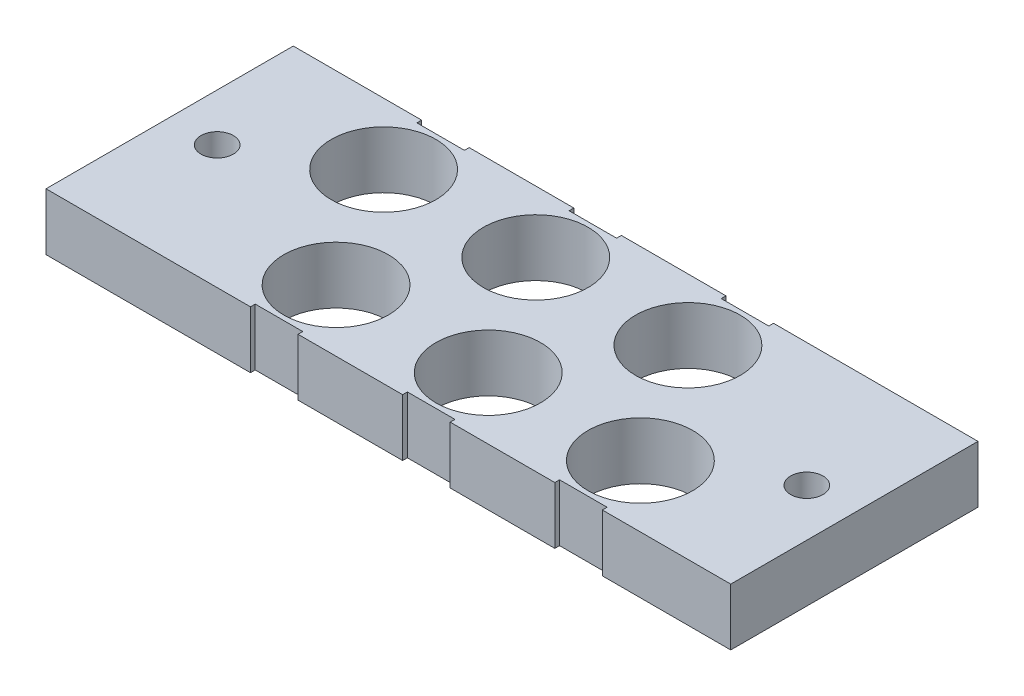
from build123d import *

# Parameters (mm, degrees)
SKETCH1_R             = 5.5
BOSS_EXTRUDE1_DEPTH   = 6
BOSS_EXTRUDE1_2_DEPTH = 6
BOSS_EXTRUDE1_3_DEPTH = 6
BOSS_EXTRUDE1_4_DEPTH = 6
BOSS_EXTRUDE1_5_DEPTH = 6
BOSS_EXTRUDE1_6_DEPTH = 6
SKETCH1_3_R           = 1.7
BOSS_EXTRUDE2_DEPTH   = 6
CUT_EXTRUDE1_DEPTH    = 1


with BuildPart() as part:
    # Sketch1 → Boss-Extrude1 (new body)
    with BuildSketch(Plane(origin=(0, 0, 0), x_dir=(1, 0, 0), z_dir=(0, 1, 0))):
        Polygon((2.68639507, -4.66487452), (-9.31360493, -4.664874562), (-9.313604887, -16.664874562), (2.686395113, -16.66487452), align=None)
        with Locations((-3.313604908, -10.664874541)):
            Circle(SKETCH1_R, mode=Mode.SUBTRACT)
    extrude(amount=-BOSS_EXTRUDE1_DEPTH)



with BuildPart() as body_2:
    # Sketch1 → Boss-Extrude1 2 (new body)
    with BuildSketch(Plane(origin=(0, 0, 0), x_dir=(1, 0, 0), z_dir=(0, 1, 0))):
        Polygon((18.68639507, -4.664873819), (6.68639507, -4.664873862), (6.686395113, -16.664873862), (18.686395113, -16.664873819), align=None)
        with Locations((12.686395092, -10.66487384)):
            Circle(SKETCH1_R, mode=Mode.SUBTRACT)
    extrude(amount=-BOSS_EXTRUDE1_2_DEPTH)


with BuildPart() as body_3:
    # Sketch1 → Boss-Extrude1 3 (new body)
    with BuildSketch(Plane(origin=(0, 0, 0), x_dir=(1, 0, 0), z_dir=(0, 1, 0))):
        Polygon((-1.313604837, -29.664873456), (10.686395163, -29.664873413), (10.68639512, -17.664873413), (-1.31360488, -17.664873456), align=None)
        with Locations((4.686395141, -23.664873434)):
            Circle(SKETCH1_R, mode=Mode.SUBTRACT)
    extrude(amount=-BOSS_EXTRUDE1_3_DEPTH)


with BuildPart() as body_4:
    # Sketch1 → Boss-Extrude1 4 (new body)
    with BuildSketch(Plane(origin=(0, 0, 0), x_dir=(1, 0, 0), z_dir=(0, 1, 0))):
        Polygon((14.686395163, -29.664873833), (26.686395163, -29.664873791), (26.68639512, -17.664873791), (14.68639512, -17.664873833), align=None)
        with Locations((20.686395141, -23.664873812)):
            Circle(SKETCH1_R, mode=Mode.SUBTRACT)
    extrude(amount=-BOSS_EXTRUDE1_4_DEPTH)


with BuildPart() as body_5:
    # Sketch1 → Boss-Extrude1 5 (new body)
    with BuildSketch(Plane(origin=(0, 0, 0), x_dir=(1, 0, 0), z_dir=(0, 1, 0))):
        Polygon((34.68639507, -4.664873762), (22.68639507, -4.664873805), (22.686395113, -16.664873805), (34.686395113, -16.664873762), align=None)
        with Locations((28.686395092, -10.664873784)):
            Circle(SKETCH1_R, mode=Mode.SUBTRACT)
    extrude(amount=-BOSS_EXTRUDE1_5_DEPTH)


with BuildPart() as body_6:
    # Sketch1 → Boss-Extrude1 6 (new body)
    with BuildSketch(Plane(origin=(0, 0, 0), x_dir=(1, 0, 0), z_dir=(0, 1, 0))):
        Polygon((30.686395163, -29.664873979), (42.686395163, -29.664873936), (42.68639512, -17.664873936), (30.68639512, -17.664873979), align=None)
        with Locations((36.686395141, -23.664873958)):
            Circle(SKETCH1_R, mode=Mode.SUBTRACT)
    extrude(amount=-BOSS_EXTRUDE1_6_DEPTH)


with BuildPart() as part_1:
    add(part.part)

    add(body_2.part)  # Boss-Extrude2 merges body 2

    add(body_3.part)  # Boss-Extrude2 merges body 3

    add(body_4.part)  # Boss-Extrude2 merges body 4

    add(body_5.part)  # Boss-Extrude2 merges body 5

    add(body_6.part)  # Boss-Extrude2 merges body 6
    # Sketch1<3> → Boss-Extrude2 (add)
    with BuildSketch(Plane(origin=(0, 0, 0), x_dir=(1, 0, 0), z_dir=(0, 1, 0))):
        Polygon((6.186395002, -4.164873846), (3.186395002, -4.1648745), (-0.813604931, -4.164874532), (-0.81360493, -4.664874532), (2.68639507, -4.66487452), (2.686395113, -16.66487452), (-9.313604887, -16.664874562), (-9.31360493, -4.664874562), (-5.81360493, -4.66487455), (-5.813604931, -4.16487455), (-9.813604931, -4.164874564), (-19.313604998, -4.164874546), (-19.313604998, -30.16487344), (-1.813604902, -30.16487344), (2.186395164, -30.164873443), (2.186395163, -29.664873443), (-1.313604837, -29.664873456), (-1.31360488, -17.664873456), (10.68639512, -17.664873413), (10.686395163, -29.664873413), (7.186395163, -29.664873425), (7.186395164, -30.164873425), (11.186395164, -30.164873411), (14.186395098, -30.164873817), (18.186395164, -30.164873821), (18.186395163, -29.664873821), (14.686395163, -29.664873833), (14.68639512, -17.664873833), (26.68639512, -17.664873791), (26.686395163, -29.664873791), (23.186395163, -29.664873803), (23.186395164, -30.164873803), (27.186395164, -30.164873789), (30.186395098, -30.164873963), (34.186395164, -30.164873966), (34.186395163, -29.664873966), (30.686395163, -29.664873979), (30.68639512, -17.664873979), (42.68639512, -17.664873936), (42.686395163, -29.664873936), (39.186395163, -29.664873949), (39.186395164, -30.164873949), (43.186395164, -30.164873935), (52.686395098, -30.16487344), (52.686395098, -4.164874546), (35.186395002, -4.164873743), (31.186395069, -4.164873775), (31.18639507, -4.664873775), (34.68639507, -4.664873762), (34.686395113, -16.664873762), (22.686395113, -16.664873805), (22.68639507, -4.664873805), (26.18639507, -4.664873793), (26.186395069, -4.164873793), (22.186395069, -4.164873807), (19.186395002, -4.1648738), (15.186395069, -4.164873832), (15.18639507, -4.664873832), (18.68639507, -4.664873819), (18.686395113, -16.664873819), (6.686395113, -16.664873862), (6.68639507, -4.664873862), (10.18639507, -4.664873849), (10.186395069, -4.164873849), align=None)
        with Locations((-14.313604998, -17.164873993)):
            Circle(SKETCH1_3_R, mode=Mode.SUBTRACT)
        with Locations((47.686395098, -17.164873993)):
            Circle(SKETCH1_3_R, mode=Mode.SUBTRACT)
    extrude(amount=-BOSS_EXTRUDE2_DEPTH)

    # Sketch2 → Cut-Extrude1 (cut)
    # profile 1 of 2: a face of its own
    with BuildSketch(Plane(origin=(0, -6, 0), x_dir=(-1, 0, 0), z_dir=(0, -1, 0))):
        Polygon((6.699801581, -23.2390136), (8.246596453, -23.2390136), (8.246596453, -23.564654626), (6.984737478, -23.564654626), (6.984737478, -24.541577703), (8.246596453, -24.541577703), (8.246596453, -24.867218728), (6.984737478, -24.867218728), (6.984737478, -26.4140136), (6.699801581, -26.4140136), align=None)
    # profile 2 of 2: a face of its own
    with BuildSketch(Plane(origin=(0, -6, 0), x_dir=(-1, 0, 0), z_dir=(0, -1, 0))):
        with BuildLine():
            Line((9.996916965, -23.157603344), (10.216979065, -23.329964121))
            Line((10.216979065, -23.329964121), (9.378071813, -24.612811677))
            add(Edge.make_bspline(
                [(9.378071813, -24.612811677), (9.43392485, -24.603909103), (9.542872514, -24.586543627), (9.65315015, -24.583678919), (9.706892927, -24.582282831)],
                knots=[0, 0, 0, 0, 1.025318673, 2, 2, 2, 2], degree=3))
            add(Edge.make_bspline(
                [(9.706892927, -24.582282831), (9.739163887, -24.583137599), (9.802478203, -24.584814619), (9.895509725, -24.598067595), (9.984924431, -24.618695779), (10.070522851, -24.64888638), (10.152413619, -24.68743998), (10.231065003, -24.733649384), (10.30499899, -24.789897237), (10.375167554, -24.852730491), (10.438873565, -24.922323744), (10.49527613, -24.996166388), (10.542653291, -25.074181472), (10.581092491, -25.156329486), (10.610941917, -25.2424838), (10.632702138, -25.332534184), (10.645565054, -25.426542733), (10.647311749, -25.490476506), (10.648199017, -25.522952903)],
                knots=[0, 0, 0, 0, 1.044136307, 2.048553127, 3.035567123, 4.010001674, 4.980053131, 5.96154148, 6.956538004, 7.981742224, 9.006487041, 10.005615874, 10.984750588, 11.954802044, 12.935714515, 13.930994945, 14.949008866, 16, 16, 16, 16], degree=3))
            add(Edge.make_bspline(
                [(10.648199017, -25.522952903), (10.646908057, -25.567384491), (10.644367755, -25.654815343), (10.619055025, -25.782157069), (10.579721633, -25.903471565), (10.523499161, -26.016821942), (10.453665142, -26.122052845), (10.368504755, -26.215293946), (10.271038162, -26.298451765), (10.160832281, -26.36799027), (10.042229735, -26.42478018), (9.917631851, -26.465570078), (9.788248654, -26.49068294), (9.700433045, -26.493831272), (9.656011517, -26.495423856)],
                knots=[0, 0, 0, 0, 1.031375318, 2.029502543, 3.004789286, 3.987476834, 4.960371455, 5.9300674, 6.912260825, 7.929083631, 8.949397511, 9.960523116, 10.96833055, 12, 12, 12, 12], degree=3))
            add(Edge.make_bspline(
                [(9.656011517, -26.495423856), (9.613288081, -26.494037555), (9.528660436, -26.491291536), (9.404170686, -26.466829578), (9.284552092, -26.427180992), (9.170642725, -26.372558039), (9.065123312, -26.303562674), (8.970720913, -26.220502607), (8.887906232, -26.125153306), (8.818986397, -26.017529563), (8.764323119, -25.901877958), (8.723329401, -25.781284966), (8.699384238, -25.656189983), (8.69603819, -25.571389235), (8.694352863, -25.528677062)],
                knots=[0, 0, 0, 0, 1.012016664, 2.004627821, 2.994792927, 3.992885782, 4.990978636, 5.973936114, 6.964471063, 7.975201453, 8.993600317, 9.990122807, 10.98767138, 12, 12, 12, 12], degree=3))
            add(Edge.make_bspline(
                [(8.694352863, -25.528677062), (8.695424602, -25.495979475), (8.697612889, -25.429217252), (8.712892251, -25.328103455), (8.737443886, -25.224642831), (8.764939609, -25.136872955), (8.793991413, -25.064971432), (8.818169074, -25.007001837), (8.848262627, -24.947347149), (8.880351337, -24.883961779), (8.91732364, -24.818479279), (8.957524265, -24.749805236), (9.002064662, -24.679031831), (9.033288667, -24.631003882), (9.049250699, -24.606451501)],
                knots=[0, 0, 0, 0, 1.173818275, 2.396712641, 3.66331629, 4.989737886, 5.693666774, 6.447286557, 7.243889047, 8.091586357, 8.998013824, 9.943181721, 10.948533338, 12, 12, 12, 12], degree=3))
            Line((9.049250699, -24.606451501), (9.996916965, -23.157603344))
        make_face()
        with BuildLine():
            add(Edge.make_bspline(
                [(9.64710727, -24.907923856), (9.622921579, -24.908639019), (9.575469451, -24.910042162), (9.505937895, -24.917966716), (9.440309411, -24.932982832), (9.377830069, -24.952402516), (9.31916676, -24.978858553), (9.263592246, -25.010560401), (9.211746157, -25.048541998), (9.16388158, -25.091418934), (9.120507249, -25.138406483), (9.083148796, -25.188723076), (9.050925237, -25.241169384), (9.024725214, -25.296180139), (9.004323526, -25.353735218), (8.989565892, -25.413569669), (8.981352848, -25.476084793), (8.97998648, -25.518477849), (8.97928876, -25.540125379)],
                knots=[0, 0, 0, 0, 1.128956033, 2.215002439, 3.259141796, 4.2666399, 5.263148119, 6.255916712, 7.247353359, 8.256307737, 9.250603402, 10.226115518, 11.176314381, 12.118911324, 13.063945463, 14.021379252, 14.989639887, 16, 16, 16, 16], degree=3))
            add(Edge.make_bspline(
                [(8.97928876, -25.540125379), (8.97985696, -25.561579289), (8.980971114, -25.603647213), (8.991087861, -25.665640612), (9.006541115, -25.725298779), (9.029528474, -25.782314158), (9.056948579, -25.837555818), (9.093148409, -25.889022827), (9.133259351, -25.939841033), (9.181205419, -25.986106654), (9.232661612, -26.029156591), (9.28763556, -26.066785107), (9.344930667, -26.098976136), (9.405320457, -26.124204774), (9.467948134, -26.144909663), (9.533335493, -26.159479719), (9.601528012, -26.167717054), (9.647721485, -26.169085201), (9.67127594, -26.169782831)],
                knots=[0, 0, 0, 0, 0.989467248, 1.94019797, 2.891935182, 3.827694429, 4.772920941, 5.730924762, 6.725747692, 7.756678648, 8.79901574, 9.819492441, 10.826891316, 11.826466727, 12.835195252, 13.867842842, 14.912794438, 16, 16, 16, 16], degree=3))
            add(Edge.make_bspline(
                [(9.67127594, -26.169782831), (9.694830356, -26.169085146), (9.741023753, -26.167716892), (9.809216821, -26.159480335), (9.874602152, -26.144907404), (9.9372372, -26.124212963), (9.997599783, -26.09894576), (10.054844781, -26.066985375), (10.109298837, -26.028925183), (10.16078881, -25.986180223), (10.208535311, -25.939577707), (10.249608271, -25.889476459), (10.28469949, -25.837139854), (10.313214788, -25.782531768), (10.335948959, -25.725264304), (10.351480576, -25.665649848), (10.361576431, -25.603644795), (10.362693456, -25.561578473), (10.363263119, -25.540125379)],
                knots=[0, 0, 0, 0, 1.087397944, 2.132534446, 3.165364764, 4.174271784, 5.174024072, 6.181601208, 7.194203697, 8.236725232, 9.267838612, 10.269026844, 11.221737037, 12.171628256, 13.107553087, 14.05945871, 15.010357665, 16, 16, 16, 16], degree=3))
            add(Edge.make_bspline(
                [(10.363263119, -25.540125379), (10.362763924, -25.518449609), (10.361784167, -25.475907121), (10.350702565, -25.413597625), (10.335333378, -25.35343124), (10.31212604, -25.29578579), (10.28197527, -25.240889945), (10.245252874, -25.18846183), (10.202761835, -25.138117296), (10.153715725, -25.091298499), (10.100325283, -25.048806355), (10.043918117, -25.010417813), (9.98414317, -24.979153645), (9.922078942, -24.95231253), (9.856977887, -24.933290658), (9.789551091, -24.917919833), (9.719159645, -24.910108409), (9.671290808, -24.908657076), (9.64710727, -24.907923856)],
                knots=[0, 0, 0, 0, 0.978753431, 1.920974676, 2.853199117, 3.782215702, 4.721507756, 5.67862441, 6.671401678, 7.694929396, 8.738190014, 9.75360867, 10.774035531, 11.783329636, 12.805060902, 13.835252836, 14.906360638, 16, 16, 16, 16], degree=3))
        make_face(mode=Mode.SUBTRACT)
    extrude(amount=-CUT_EXTRUDE1_DEPTH, mode=Mode.SUBTRACT)


solid = part_1.part
